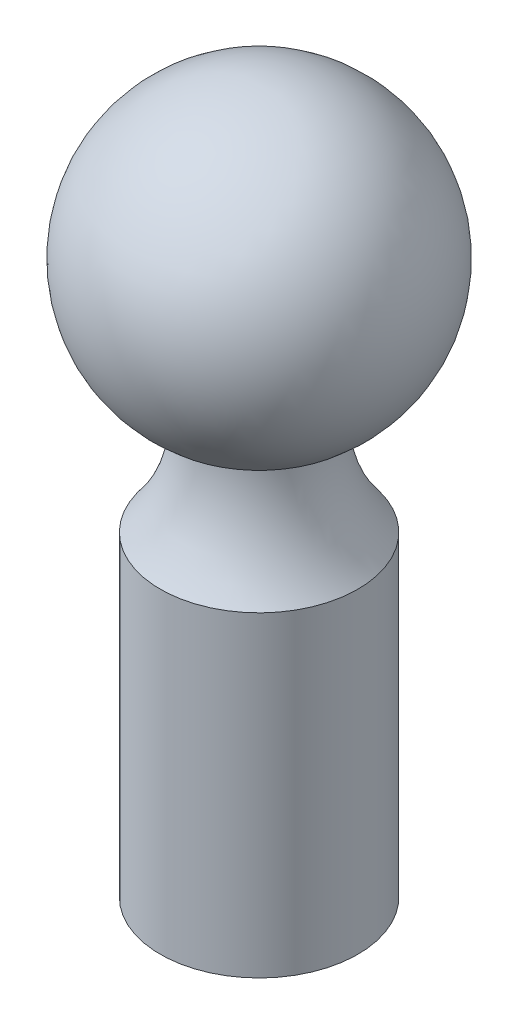
from build123d import *

# Parameters (mm, degrees)
SKETCH2_R           = 4
BOSS_EXTRUDE1_DEPTH = 15
SKETCH3_R           = 6.25
BOSS_EXTRUDE2_DEPTH = 20
FILLET1_R           = 10


with BuildPart() as part:
    # Sketch1 → Revolve1 (revolve)
    with BuildSketch(Plane.XY):
        with BuildLine():
            Line((0, 0), (0, 9.5))
            ThreePointArc((0, 9.5), (-9.5, 0), (0, -9.5))
            Line((0, -9.5), (0, 0))
        make_face()
    revolve(axis=Axis((0, 0, 0), (0, 1, 0)))

    # Sketch2 → Boss-Extrude1 (add)
    with BuildSketch(Plane(origin=(0, 0, 0), x_dir=(1, 0, 0), z_dir=(0, 1, 0))):
        with Locations(Location((0, 0, 0), (0, 0, 270))):
            Circle(SKETCH2_R)
    extrude(amount=-BOSS_EXTRUDE1_DEPTH)

    # Sketch3 → Boss-Extrude2 (add)
    with BuildSketch(Plane.XZ.offset(15)):
        with Locations(Location((0, 0, 0), (0, 0, 270))):
            Circle(SKETCH3_R)
    extrude(amount=BOSS_EXTRUDE2_DEPTH)

    # Fillet1
    # the kernel refuses this fillet: 10 mm, written as the material it adds along each edge
    with BuildSketch(Plane(origin=(0, -15, 0), x_dir=(0, 0, 1), z_dir=(-1, 0, 0))) as fillet1_piece_1:
        with BuildLine():
            CenterArc((14, 6.31961233), FILLET1_R, 180, 39.194967426)
            Line((4, 6.31961233), (3.8, 6.31961233))
            Line((3.8, 6.31961233), (3.8, 0))
            Line((3.8, 0), (4, -0.2))
            ThreePointArc((4, -0.2), (5.125, -0.2), (6.095, -0.126392247))
            Line((6.095, -0.126392247), (6.25, 0))
        make_face()
    revolve(axis=Axis((0, -15, 0), (0, 1, 0)))


solid = part.part
